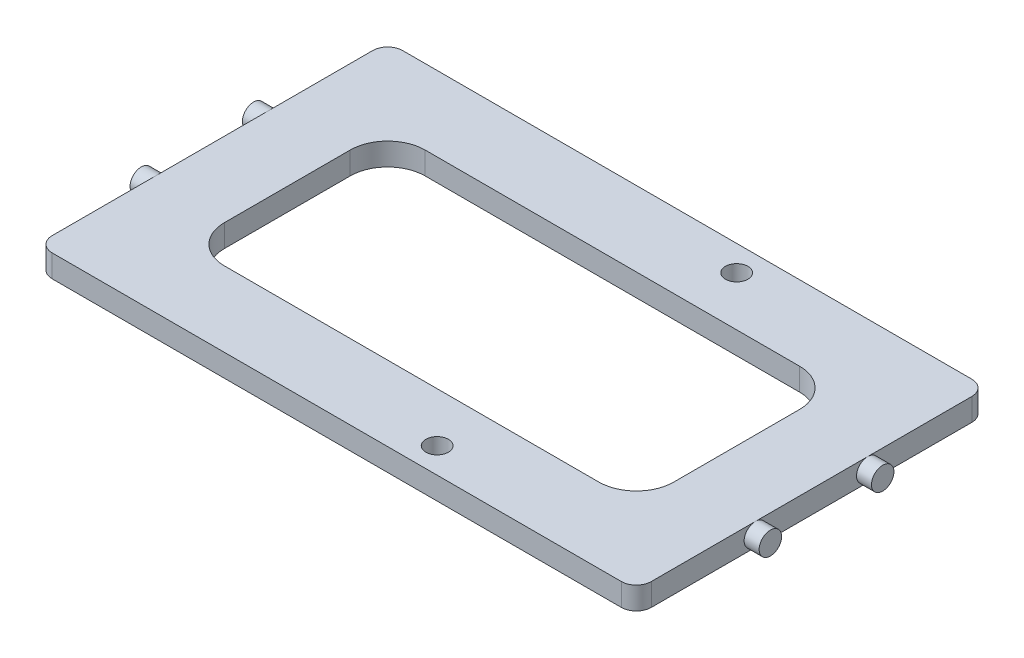
from build123d import *

# Parameters (mm, degrees)
SKETCH1_W                       = 101.6
SKETCH1_H                       = 59.436
BASE_EXTRUDE_DEPTH              = 3.81
BASE_CORNER_FILLET_R            = 2.54
SKETCH3_R                       = 1.905
PEG_EXTRUDE_DEPTH               = 2.54
MATERIAL_REMOVAL_CUT_DEPTH      = 120.96788652
SKETCH5_R                       = 1.905
REMOTE_CONTROL_HOLDER_CUT_DEPTH = 120.96788652


with BuildPart() as part:
    # Sketch1 → Base Extrude (new body)
    with BuildSketch(Plane(origin=(0, 0, 0), x_dir=(1, 0, 0), z_dir=(0, 1, 0))):
        with Locations((50.8, 29.718)):
            Rectangle(SKETCH1_W, SKETCH1_H)
    extrude(amount=BASE_EXTRUDE_DEPTH)

    # Base Corner Fillet
    base_corner_fillet_edges = [part.edges().sort_by_distance(p)[0] for p in [
        (0, 1.905, 0),
        (0, 1.905, -59.436),
        (101.6, 1.905, -59.436),
        (101.6, 1.905, 0),
    ]]
    fillet(base_corner_fillet_edges, radius=BASE_CORNER_FILLET_R)

    # Sketch3 → Peg Extrude (add)
    with BuildSketch(Plane.ZY):
        with Locations((-20.193, 1.905)):
            Circle(SKETCH3_R)
        with Locations((-39.243, 1.905)):
            Circle(SKETCH3_R)
    peg_extrude = extrude(amount=PEG_EXTRUDE_DEPTH)

    # Peg Mirror: Peg Extrude across plane
    add(peg_extrude.mirror(Plane(origin=(50.8, 0, 0), x_dir=(0, 0, 1), z_dir=(1, 0, 0))))

    # Sketch4 → Material Removal Cut (cut, through all)
    with BuildSketch(Plane.XZ):
        with BuildLine():
            Line((19.05, -12.7), (82.55, -12.7))
            ThreePointArc((82.55, -12.7), (87.040128061, -14.559871939), (88.9, -19.05))
            Line((88.9, -19.05), (88.9, -40.386))
            ThreePointArc((88.9, -40.386), (87.040128061, -44.876128061), (82.55, -46.736))
            Line((82.55, -46.736), (19.05, -46.736))
            ThreePointArc((19.05, -46.736), (14.559871939, -44.876128061), (12.7, -40.386))
            Line((12.7, -40.386), (12.7, -19.05))
            ThreePointArc((12.7, -19.05), (14.559871939, -14.559871939), (19.05, -12.7))
        make_face()
    extrude(amount=-MATERIAL_REMOVAL_CUT_DEPTH, mode=Mode.SUBTRACT)

    # Sketch5 → Remote Control Holder Cut (cut, through all)
    with BuildSketch(Plane(origin=(0, 3.81, 0), x_dir=(1, 0, 0), z_dir=(0, 1, 0))):
        with Locations((63.5, 4.318)):
            Circle(SKETCH5_R)
        with Locations((63.5, 55.118)):
            Circle(SKETCH5_R)
    extrude(amount=-REMOTE_CONTROL_HOLDER_CUT_DEPTH, mode=Mode.SUBTRACT)


solid = part.part
